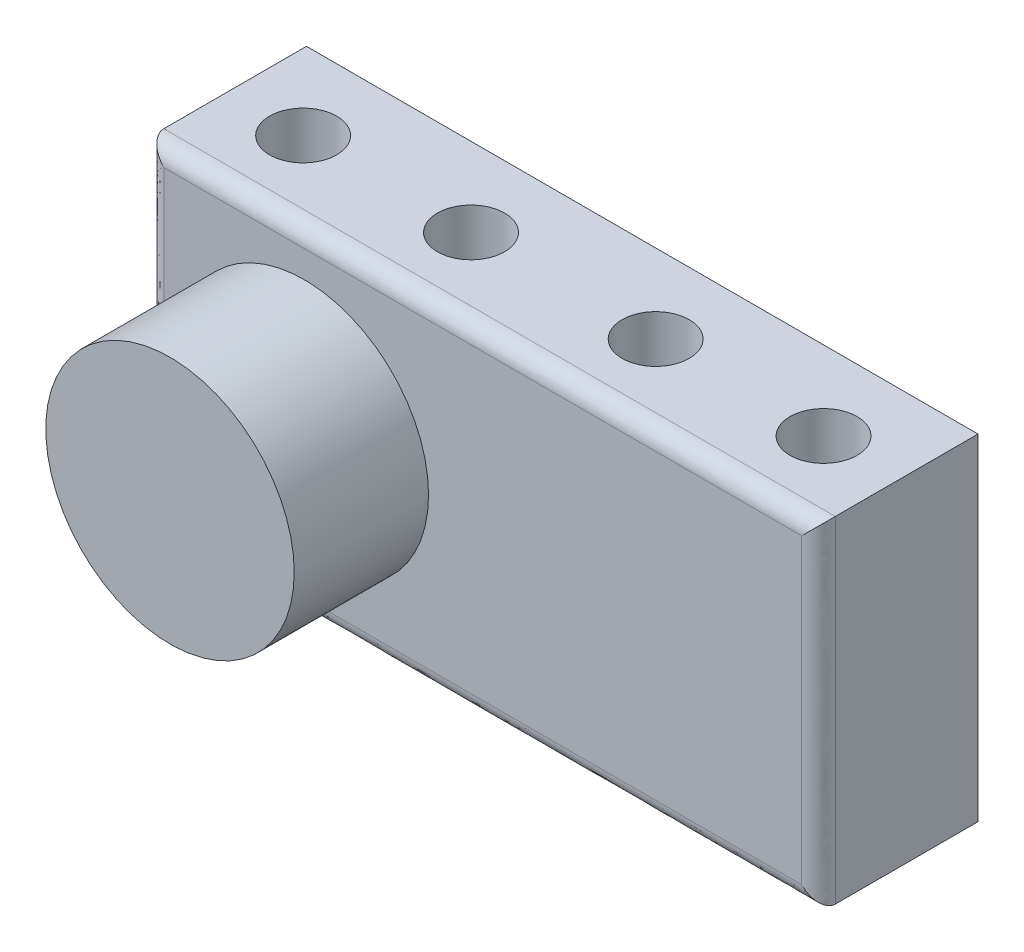
from build123d import *

# Parameters (mm, degrees)
SKETCH1_W           = 40
SKETCH1_H           = 20
BOSS_EXTRUDE1_DEPTH = 9.5
FILLET1_R           = 1
SKETCH4_R           = 7.4
BOSS_EXTRUDE2_DEPTH = 8
SKETCH5_R           = 2
CUT_EXTRUDE1_DEPTH  = 34.260336739


with BuildPart() as part:
    # Sketch1 → Boss-Extrude1 (new body)
    with BuildSketch(Plane.XY):
        Rectangle(SKETCH1_W, SKETCH1_H)
    extrude(amount=BOSS_EXTRUDE1_DEPTH)

    # Fillet1
    fillet1_edges = [part.edges().sort_by_distance(p)[0] for p in [
        (0, -10, 9.5),
        (20, 0, 9.5),
        (0, 10, 9.5),
        (-20, 0, 9.5),
    ]]
    fillet(fillet1_edges, radius=FILLET1_R)

    # Sketch4 → Boss-Extrude2 (add)
    with BuildSketch(Plane.XY.offset(9.5)):
        with Locations((-10.628602575, 0)):
            Circle(SKETCH4_R)
    extrude(amount=BOSS_EXTRUDE2_DEPTH)

    # Sketch5 → Cut-Extrude1 (cut, through all)
    with BuildSketch(Plane.XZ.offset(10)):
        with Locations((-15.5, 4.7)):
            Circle(SKETCH5_R)
        with Locations((-5.5, 4.7)):
            Circle(SKETCH5_R)
        with Locations((5.5, 4.7)):
            Circle(SKETCH5_R)
        with Locations((15.5, 4.7)):
            Circle(SKETCH5_R)
    extrude(amount=-CUT_EXTRUDE1_DEPTH, mode=Mode.SUBTRACT)


solid = part.part
